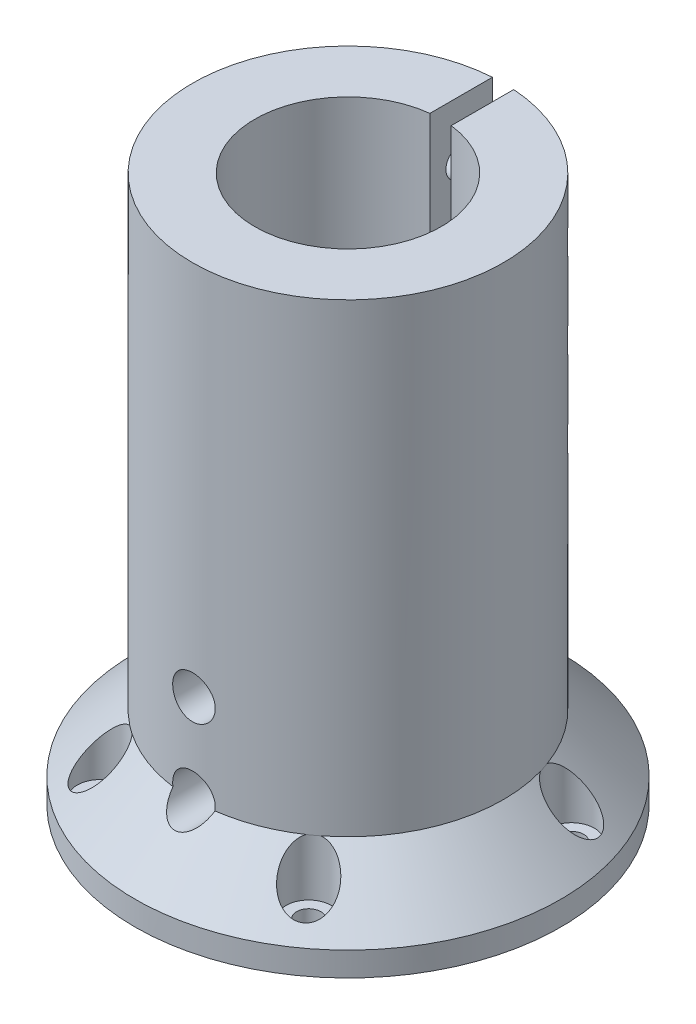
from build123d import *

# Parameters (mm, degrees)
SKETCH1_R           = 30
SKETCH1_R_2         = 1.7
SKETCH1_R_3         = 17.5
BOSS_EXTRUDE1_DEPTH = 3
BOSS_EXTRUDE2_START = -3
SKETCH2_R           = 21.9
SKETCH2_R_2         = 17.5
BOSS_EXTRUDE2_DEPTH = 32
CHAMFER1_SIZE       = 8.5
CUT_EXTRUDE3_START  = 8
SKETCH3_R           = 3.2
SKETCH3_R_2         = 1.7
CUT_EXTRUDE3_DEPTH  = 8
SKETCH4_R           = 3
CUT_EXTRUDE4_DEPTH  = 54.141321135
SKETCH5_R           = 21.9
SKETCH5_R_2         = 13.125
BOSS_EXTRUDE3_DEPTH = 45
CHAMFER2_SIZE       = 4.5
SKETCH6_W           = 3
SKETCH6_H           = 17.55
CUT_EXTRUDE5_DEPTH  = 40
SKETCH8_R           = 2.15
CUT_EXTRUDE6_DEPTH  = 89.437831428
CUT_EXTRUDE7_START  = -16
SKETCH9_R           = 3.15
CUT_EXTRUDE7_DEPTH  = 10
SKETCH10_R          = 1.75
CUT_EXTRUDE8_DEPTH  = 89.437831428
CUT_EXTRUDE9_START  = -20
SKETCH11_R          = 3
CUT_EXTRUDE9_DEPTH  = 14


with BuildPart() as part:
    # Sketch1 → Boss-Extrude1 (new body)
    with BuildSketch(Plane(origin=(0, 0, 0), x_dir=(1, 0, 0), z_dir=(0, 1, 0))):
        with Locations(Location((0, 0, 0), (0, 0, 270))):
            Circle(SKETCH1_R)
        with Locations(Location((0, 25, 0), (0, 0, 270))):
            Circle(SKETCH1_R_2, mode=Mode.SUBTRACT)
        with Locations(Location((23.776412907, 7.725424859, 0), (0, 0, 270))):
            Circle(SKETCH1_R_2, mode=Mode.SUBTRACT)
        with Locations(Location((14.694631307, -20.225424859, 0), (0, 0, 270))):
            Circle(SKETCH1_R_2, mode=Mode.SUBTRACT)
        with Locations(Location((-14.694631307, -20.225424859, 0), (0, 0, 270))):
            Circle(SKETCH1_R_2, mode=Mode.SUBTRACT)
        with Locations(Location((-23.776412907, 7.725424859, 0), (0, 0, 270))):
            Circle(SKETCH1_R_2, mode=Mode.SUBTRACT)
        with Locations(Location((0, 0, 0), (0, 0, 270))):
            Circle(SKETCH1_R_3, mode=Mode.SUBTRACT)
    extrude(amount=BOSS_EXTRUDE1_DEPTH)

    # Sketch2 → Boss-Extrude2 (add)
    with BuildSketch(Plane(origin=(0, 3, 0), x_dir=(1, 0, 0), z_dir=(0, 1, 0)).offset(BOSS_EXTRUDE2_START)):
        with Locations(Location((0, 0, 0), (0, 0, 270))):
            Circle(SKETCH2_R)
        with Locations(Location((0, 0, 0), (0, 0, 270))):
            Circle(SKETCH2_R_2, mode=Mode.SUBTRACT)
    extrude(amount=BOSS_EXTRUDE2_DEPTH)

    # Chamfer1
    # the kernel refuses this chamfer: 8.5 mm, written as the material it adds along each edge
    with BuildSketch(Plane(origin=(0, 3, 0), x_dir=(0, 0, 1), z_dir=(1, 0, 0))) as chamfer1_piece_1_section:
        Polygon((21.9 + CHAMFER1_SIZE, 0), (21.9, -CHAMFER1_SIZE), (21.9, 0), align=None)
    chamfer1_piece_1 = revolve(axis=Axis((0, 3, 0), (0, -1, 0)), mode=Mode.PRIVATE)
    chamfer1_piece_1 = chamfer1_piece_1 & Plane(origin=(0, 4.662568968, 0), x_dir=(0, 0, 1), z_dir=(0, -1, 0)) * Cylinder(30, 122, mode=Mode.PRIVATE)
    chamfer1_piece_1 = chamfer1_piece_1 - Plane(origin=(-14.694631307, 4.662568968, 20.225424859), x_dir=(0, 0, 1), z_dir=(0, -1, 0)) * Cylinder(1.7, 122, mode=Mode.PRIVATE)
    chamfer1_piece_1 = chamfer1_piece_1 - Plane(origin=(14.694631307, 4.662568968, 20.225424859), x_dir=(0, 0, 1), z_dir=(0, -1, 0)) * Cylinder(1.7, 122, mode=Mode.PRIVATE)
    chamfer1_piece_1 = chamfer1_piece_1 - Plane(origin=(-23.776412907, 4.662568968, -7.725424859), x_dir=(0, 0, 1), z_dir=(0, -1, 0)) * Cylinder(1.7, 122, mode=Mode.PRIVATE)
    chamfer1_piece_1 = chamfer1_piece_1 - Plane(origin=(0, 4.662568968, -25), x_dir=(0, 0, 1), z_dir=(0, -1, 0)) * Cylinder(1.7, 122, mode=Mode.PRIVATE)
    chamfer1_piece_1 = chamfer1_piece_1 - Plane(origin=(23.776412907, 4.662568968, -7.725424859), x_dir=(0, 0, 1), z_dir=(0, -1, 0)) * Cylinder(1.7, 122, mode=Mode.PRIVATE)
    add(chamfer1_piece_1)

    # Sketch3 → Cut-Extrude3 (cut)
    # profile 1 of 5: a face of its own
    with BuildSketch(Plane(origin=(0, 11.5, 0), x_dir=(-1, 0, 0), z_dir=(0, -1, 0)).offset(CUT_EXTRUDE3_START)):
        with Locations(Location((0, 25, 0), (0, 0, 90))):
            Circle(SKETCH3_R)
        with Locations(Location((0, 25, 0), (0, 0, 90))):
            Circle(SKETCH3_R_2, mode=Mode.SUBTRACT)
    # profile 2 of 5: a face of its own
    with BuildSketch(Plane(origin=(0, 11.5, 0), x_dir=(-1, 0, 0), z_dir=(0, -1, 0)).offset(CUT_EXTRUDE3_START)):
        with Locations(Location((23.776412907, 7.725424859, 0), (0, 0, 211.421832569))):
            Circle(SKETCH3_R)
        with Locations(Location((23.776412907, 7.725424859, 0), (0, 0, 90))):
            Circle(SKETCH3_R_2, mode=Mode.SUBTRACT)
    # profile 3 of 5: a face of its own
    with BuildSketch(Plane(origin=(0, 11.5, 0), x_dir=(-1, 0, 0), z_dir=(0, -1, 0)).offset(CUT_EXTRUDE3_START)):
        with Locations(Location((14.694631307, -20.225424859, 0), (0, 0, 139.421832569))):
            Circle(SKETCH3_R)
        with Locations(Location((14.694631307, -20.225424859, 0), (0, 0, 90))):
            Circle(SKETCH3_R_2, mode=Mode.SUBTRACT)
    # profile 4 of 5: a face of its own
    with BuildSketch(Plane(origin=(0, 11.5, 0), x_dir=(-1, 0, 0), z_dir=(0, -1, 0)).offset(CUT_EXTRUDE3_START)):
        with Locations(Location((-14.694631307, -20.225424859, 0), (0, 0, 40.578167146))):
            Circle(SKETCH3_R)
        with Locations(Location((-14.694631307, -20.225424859, 0), (0, 0, 90))):
            Circle(SKETCH3_R_2, mode=Mode.SUBTRACT)
    # profile 5 of 5: a face of its own
    with BuildSketch(Plane(origin=(0, 11.5, 0), x_dir=(-1, 0, 0), z_dir=(0, -1, 0)).offset(CUT_EXTRUDE3_START)):
        with Locations(Location((-23.776412907, 7.725424859, 0), (0, 0, 328.578167146))):
            Circle(SKETCH3_R)
        with Locations(Location((-23.776412907, 7.725424859, 0), (0, 0, 90))):
            Circle(SKETCH3_R_2, mode=Mode.SUBTRACT)
    extrude(amount=-CUT_EXTRUDE3_DEPTH, mode=Mode.SUBTRACT)

    # Sketch4 → Cut-Extrude4 (cut, through all)
    with BuildSketch(Plane.XY):
        with Locations(Location((0, 12, 0), (0, 0, 180))):
            Circle(SKETCH4_R)
        with Locations(Location((0, 24, 0), (0, 0, 180))):
            Circle(SKETCH4_R)
    extrude(amount=CUT_EXTRUDE4_DEPTH, mode=Mode.SUBTRACT)

    # Sketch5 → Boss-Extrude3 (add)
    with BuildSketch(Plane(origin=(0, 32, 0), x_dir=(1, 0, 0), z_dir=(0, 1, 0))):
        with Locations(Location((0, 0, 0), (0, 0, 88.056333856))):
            Circle(SKETCH5_R)
        with Locations(Location((0, 0, 0), (0, 0, 90))):
            Circle(SKETCH5_R_2, mode=Mode.SUBTRACT)
    extrude(amount=BOSS_EXTRUDE3_DEPTH)

    # Chamfer2
    # the kernel refuses this chamfer: 4.5 mm, written as the material it adds along each edge
    with BuildSketch(Plane(origin=(0, 32, 0), x_dir=(0, 0, 1), z_dir=(-1, 0, 0))) as chamfer2_piece_1_section:
        Polygon((17.5, -CHAMFER2_SIZE), (17.5 - CHAMFER2_SIZE, 0), (17.5, 0), align=None)
    chamfer2_piece_1 = revolve(axis=Axis((0, 32, 0), (0, 1, 0)), mode=Mode.PRIVATE)
    chamfer2_piece_1 = chamfer2_piece_1 - Plane(origin=(0, 29.697227315, 0), x_dir=(0, 0, -1), z_dir=(0, -1, 0)) * Cylinder(13.125, 71, mode=Mode.PRIVATE)
    add(chamfer2_piece_1)

    # Sketch6 → Cut-Extrude5 (cut)
    with BuildSketch(Plane(origin=(0, 77, 0), x_dir=(1, 0, 0), z_dir=(0, 1, 0))):
        with Locations((0, 13.125)):
            Rectangle(SKETCH6_W, SKETCH6_H)
    extrude(amount=-CUT_EXTRUDE5_DEPTH, mode=Mode.SUBTRACT)

    # Sketch8 → Cut-Extrude6 (cut, through all)
    with BuildSketch(Plane(origin=(-1.5, 0, 0), x_dir=(0, 0, -1), z_dir=(1, 0, 0))):
        with Locations((17.443786868, 57)):
            Circle(SKETCH8_R)
        with Locations((17.443786868, 69)):
            Circle(SKETCH8_R)
        with Locations((17.443786868, 45)):
            Circle(SKETCH8_R)
    extrude(amount=-CUT_EXTRUDE6_DEPTH, mode=Mode.SUBTRACT)

    # Sketch9 → Cut-Extrude7 (cut)
    with BuildSketch(Plane(origin=(-1.5, 0, 0), x_dir=(0, 0, -1), z_dir=(1, 0, 0)).offset(CUT_EXTRUDE7_START)):
        with Locations((17.443786868, 45)):
            Circle(SKETCH9_R)
        with Locations((17.443786868, 57)):
            Circle(SKETCH9_R)
        with Locations((17.443786868, 69)):
            Circle(SKETCH9_R)
    extrude(amount=CUT_EXTRUDE7_DEPTH, mode=Mode.SUBTRACT)

    # Sketch10 → Cut-Extrude8 (cut, through all)
    with BuildSketch(Plane.ZY.offset(-1.5)):
        with Locations((-17.443786868, 45)):
            Circle(SKETCH10_R)
        with Locations((-17.443786868, 57)):
            Circle(SKETCH10_R)
        with Locations((-17.443786868, 69)):
            Circle(SKETCH10_R)
    extrude(amount=-CUT_EXTRUDE8_DEPTH, mode=Mode.SUBTRACT)

    # Sketch11 → Cut-Extrude9 (cut)
    with BuildSketch(Plane.ZY.offset(-1.5).offset(CUT_EXTRUDE9_START)):
        with Locations(Location((-17.443786868, 45, 0), (0, 0, 180))):
            Circle(SKETCH11_R)
        with Locations(Location((-17.443786868, 57, 0), (0, 0, 180))):
            Circle(SKETCH11_R)
        with Locations(Location((-17.443786868, 69, 0), (0, 0, 180))):
            Circle(SKETCH11_R)
    extrude(amount=CUT_EXTRUDE9_DEPTH, mode=Mode.SUBTRACT)


solid = part.part
